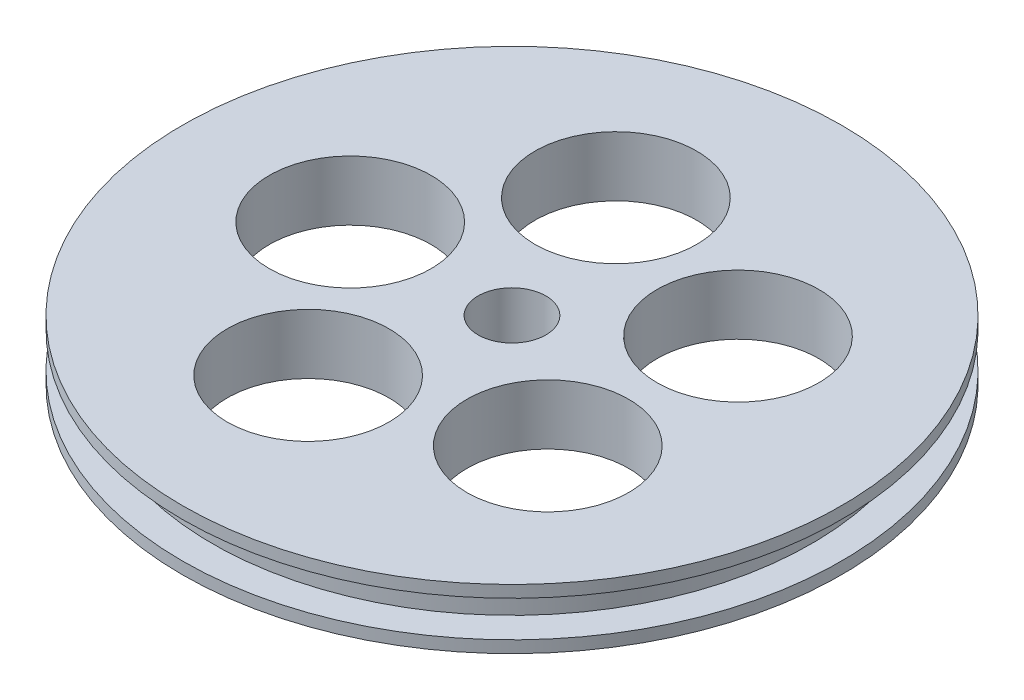
from build123d import *

# Parameters (mm, degrees)
SKETCH3_R          = 5.653749864
SKETCH3_R_2        = 13.5
CUT_EXTRUDE1_DEPTH = 10


with BuildPart() as part:
    # Sketch1 → Revolve4 (revolve)
    with BuildSketch(Plane(origin=(0, 0, 0), x_dir=(0, 0, -1), z_dir=(1, 0, 0))):
        Polygon((0, -2), (50, -2), (50, 0), (45, 0), (45, 6), (50, 6), (50, 8), (0, 8), align=None)
    revolve(axis=Axis((0, 3, 5), (0, 1, 0)))

    # Sketch3 → Cut-Extrude1 (cut)
    with BuildSketch(Plane(origin=(0, 8, 0), x_dir=(1, 0, 0), z_dir=(0, 1, 0))):
        with Locations((0, -5)):
            Circle(SKETCH3_R)
        with Locations((-27, -5)):
            Circle(SKETCH3_R_2)
        with Locations((-8.343458848, 20.67852594)):
            Circle(SKETCH3_R_2)
        with Locations((21.843458848, 10.870201812)):
            Circle(SKETCH3_R_2)
        with Locations((21.843458848, -20.870201812)):
            Circle(SKETCH3_R_2)
        with Locations((-8.343458848, -30.67852594)):
            Circle(SKETCH3_R_2)
    extrude(amount=-CUT_EXTRUDE1_DEPTH, mode=Mode.SUBTRACT)


solid = part.part
